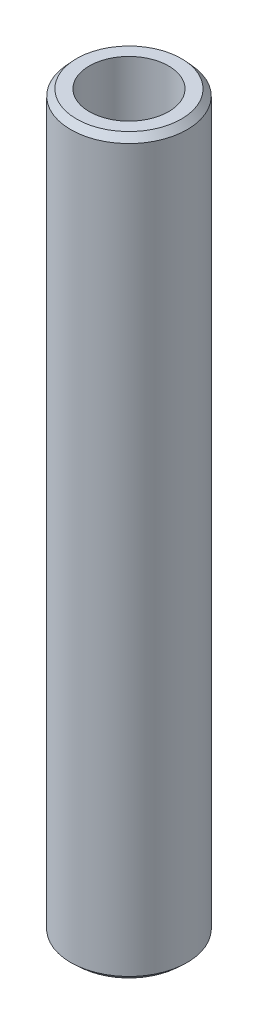
from build123d import *
from OCP.BRepFilletAPI import BRepFilletAPI_MakeChamfer

# Parameters (mm, degrees)
SKETCH1_R           = 17.5
BOSS_EXTRUDE1_DEPTH = 220.509976348
SKETCH2_R           = 11.922820063
CUT_EXTRUDE1_DEPTH  = 222.894456147
CHAMFER1_SIZE       = 1.895009826
CHAMFER1_SIZE2      = 1.741763605


with BuildPart() as part:
    # Sketch1 → Boss-Extrude1 (new body)
    with BuildSketch(Plane(origin=(0, 0, 0), x_dir=(1, 0, 0), z_dir=(0, 1, 0))):
        Circle(SKETCH1_R)
    extrude(amount=BOSS_EXTRUDE1_DEPTH)

    # Sketch2 → Cut-Extrude1 (cut, through all)
    with BuildSketch(Plane(origin=(0, 0, 0), x_dir=(1, 0, 0), z_dir=(0, 1, 0))):
        Circle(SKETCH2_R)
    extrude(amount=CUT_EXTRUDE1_DEPTH, mode=Mode.SUBTRACT)

    # Chamfer1: one chamfer whose edges measure the first distance from different faces: ONE call of the kernel's chamfer builder (chamfer() names one face for all edges)
    chamfer1_edges_1 = [part.edges().sort_by_distance(p)[0] for p in [
        (-17.5, 220.509976348, 0),
    ]]
    chamfer1_side_1 = [part.faces().sort_by_distance(p)[0] for p in [
        (-17.5, 110.254988174, 0),
    ]]
    chamfer1_edges_2 = [part.edges().sort_by_distance(p)[0] for p in [
        (-17.5, 0, 0),
    ]]
    chamfer1_side_2 = [part.faces().sort_by_distance(p)[0] for p in [
        (-17.005025253, 0, 0),
    ]]
    chamfer1 = BRepFilletAPI_MakeChamfer(part.part.solid().wrapped)
    for e in chamfer1_edges_1:
        chamfer1.Add(CHAMFER1_SIZE, CHAMFER1_SIZE2, e.wrapped, chamfer1_side_1[0].wrapped)  # the first distance lies on this face
    for e in chamfer1_edges_2:
        chamfer1.Add(CHAMFER1_SIZE, CHAMFER1_SIZE2, e.wrapped, chamfer1_side_2[0].wrapped)  # the first distance lies on this face
    add(Compound.cast(chamfer1.Shape()), mode=Mode.REPLACE)


solid = part.part
